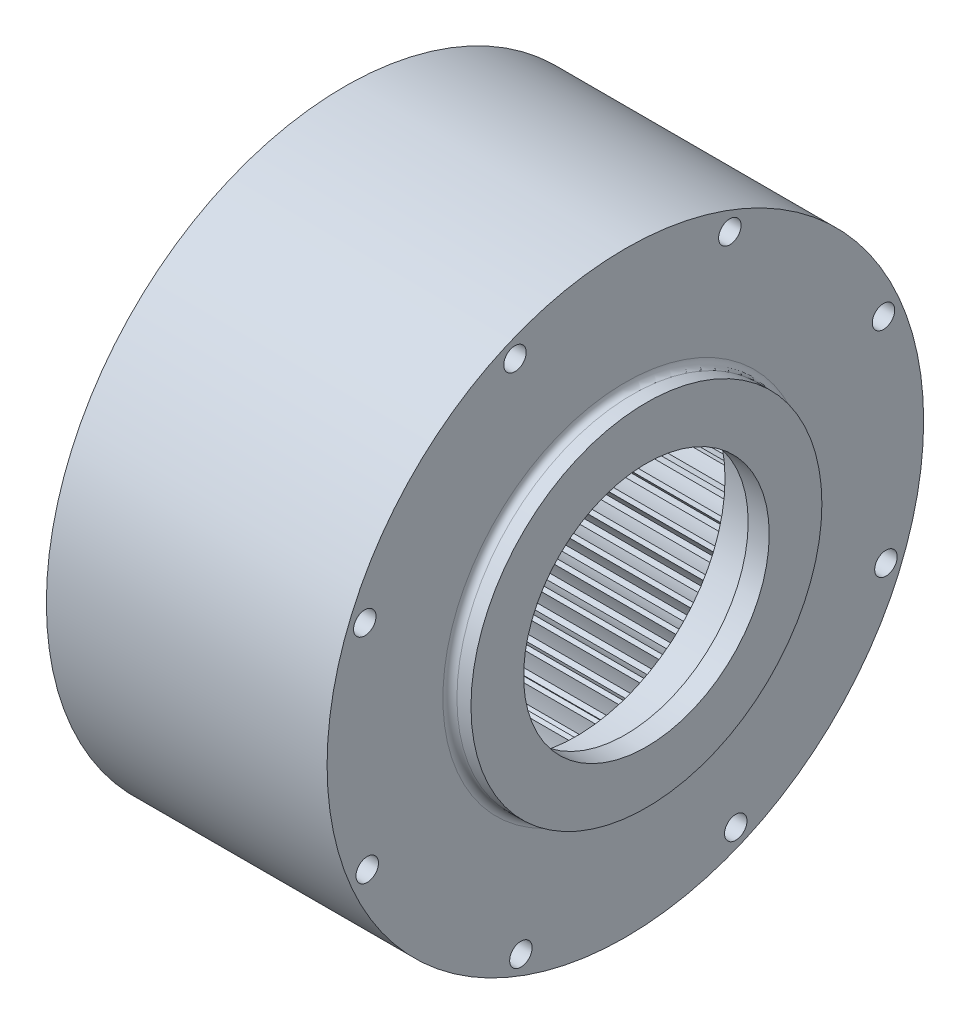
from build123d import *

# Parameters (mm, degrees)
BASPROSKE_W         = 30
BASPROSKE_H         = 8.5
TOOTHCUT_DEPTH      = 68.175144213
TEETHCUTS_COUNT     = 70
TEETHCUTS_ANGLE     = 354.857142857
BOSS_EXTRUDE1_START = 7
SKETCH1_R           = 42.5
SKETCH1_R_2         = 21.2
BOSS_EXTRUDE1_DEPTH = 7
SKETCH2_R           = 24.999999999
SKETCH2_R_2         = 17.499999999
BOSS_EXTRUDE2_DEPTH = 3
FILLET1_R           = 1
SKETCH4_R           = 42.5
BOSS_EXTRUDE3_DEPTH = 3
SKETCH5_R           = 1.6
CUT_EXTRUDE1_DEPTH  = 10
CUT_EXTRUDE2_START  = -20
SKETCH6_R           = 1.6
CUT_EXTRUDE2_DEPTH  = 20


with BuildPart() as part:
    # BasProSke → Base-Revolve (revolve)
    with BuildSketch(Plane(origin=(0, 0, 0), x_dir=(1, 0, 0), z_dir=(0, 1, 0))):
        with Locations((15, 38.25)):
            Rectangle(BASPROSKE_W, BASPROSKE_H)
    revolve(axis=Axis((-10, 0, 0), (1, 0, 0)))

    # TooCutSke → ToothCut (cut, through all)
    with BuildSketch(Plane(origin=(0, 0, 0), x_dir=(0, 0, -1), z_dir=(1, 0, 0))):
        with BuildLine():
            ThreePointArc((1.226311931, 33.952460945), (0.832867774, 35.11607546), (0.358768615, 36.249224627))
            ThreePointArc((0.358768615, 36.249224627), (0, 36.251), (-0.358768615, 36.249224627))
            ThreePointArc((-0.358768615, 36.249224627), (-0.832867774, 35.11607546), (-1.226311931, 33.952460945))
            ThreePointArc((-1.226311931, 33.952460945), (0, 33.9746), (1.226311931, 33.952460945))
        make_face()
    toothcut = extrude(amount=TOOTHCUT_DEPTH, mode=Mode.SUBTRACT)

    # TeethCuts: ToothCut ×70 about axis
    teethcuts_axis = Axis((-10, 0, 0), (1, 0, 0))
    for i in range(1, TEETHCUTS_COUNT):
        add(toothcut.rotate(teethcuts_axis, i * TEETHCUTS_ANGLE / (TEETHCUTS_COUNT - 1)), mode=Mode.SUBTRACT)

    # Sketch1 → Boss-Extrude1 (add)
    with BuildSketch(Plane(origin=(30, 0, 0), x_dir=(0, 0, -1), z_dir=(1, 0, 0)).offset(BOSS_EXTRUDE1_START)):
        Circle(SKETCH1_R)
        Circle(SKETCH1_R_2, mode=Mode.SUBTRACT)
    extrude(amount=-BOSS_EXTRUDE1_DEPTH)

    # Sketch2 → Boss-Extrude2 (add)
    with BuildSketch(Plane(origin=(37, 0, 0), x_dir=(0, 0, -1), z_dir=(1, 0, 0))):
        with Locations((4e-09, -9e-09)):
            Circle(SKETCH2_R)
        with Locations((4e-09, -9e-09)):
            Circle(SKETCH2_R_2, mode=Mode.SUBTRACT)
    extrude(amount=BOSS_EXTRUDE2_DEPTH)

    # Fillet1
    fillet1_edges = [part.edges().sort_by_distance(p)[0] for p in [
        (37, -9e-09, 24.999999995),
    ]]
    fillet(fillet1_edges, radius=FILLET1_R)

    # Sketch4 → Boss-Extrude3 (add)
    with BuildSketch(Plane.ZY):
        Circle(SKETCH4_R)
        with BuildLine():
            ThreePointArc((-21.59700955, 29.115359855), (-21.307803181, 29.327675063), (-21.016509736, 29.537117657))
            ThreePointArc((-21.016509736, 29.537117657), (-19.978120328, 28.906410813), (-18.985993298, 28.205177867))
            ThreePointArc((-18.985993298, 28.205177867), (-18.730497369, 28.375490627), (-18.473473761, 28.543489051))
            ThreePointArc((-18.473473761, 28.543489051), (-18.728346173, 29.731379509), (-18.900185603, 30.934090987))
            ThreePointArc((-18.900185603, 30.934090987), (-18.593111705, 31.119627217), (-18.284216633, 31.302115314))
            ThreePointArc((-18.284216633, 31.302115314), (-17.3065436, 30.580867001), (-16.381268619, 29.793523431))
            ThreePointArc((-16.381268619, 29.793523431), (-16.111534524, 29.940248083), (-15.840486355, 30.084530776))
            ThreePointArc((-15.840486355, 30.084530776), (-15.987851045, 31.290485724), (-16.051188474, 32.503759007))
            ThreePointArc((-16.051188474, 32.503759007), (-15.728719427, 32.66102243), (-15.404709768, 32.815086743))
            ThreePointArc((-15.404709768, 32.815086743), (-14.49562476, 32.009104028), (-13.644651597, 31.141989063))
            ThreePointArc((-13.644651597, 31.141989063), (-13.362851076, 31.263944267), (-13.079960666, 31.38334955))
            ThreePointArc((-13.079960666, 31.38334955), (-13.118631142, 32.597659346), (-13.072956614, 33.811725871))
            ThreePointArc((-13.072956614, 33.811725871), (-12.737688748, 33.939450296), (-12.401173239, 34.063850389))
            ThreePointArc((-12.401173239, 34.063850389), (-11.567995673, 33.179622572), (-10.798175864, 32.23971771))
            ThreePointArc((-10.798175864, 32.23971771), (-10.506577809, 32.335921554), (-10.214122826, 32.429488046))
            ThreePointArc((-10.214122826, 32.429488046), (-10.143787734, 33.642375783), (-9.989468995, 34.847460599))
            ThreePointArc((-9.989468995, 34.847460599), (-9.644101689, 34.944617663), (-9.297789754, 35.03835194))
            ThreePointArc((-9.297789754, 35.03835194), (-8.547227886, 34.082998304), (-7.864759568, 33.077871106))
            ThreePointArc((-7.864759568, 33.077871106), (-7.565711755, 33.147549014), (-7.266046873, 33.214523372))
            ThreePointArc((-7.266046873, 33.214523372), (-7.087272512, 34.416223591), (-6.825552044, 35.602624065))
            ThreePointArc((-6.825552044, 35.602624065), (-6.472865993, 35.668431516), (-6.119545932, 35.730745284))
            ThreePointArc((-6.119545932, 35.730745284), (-5.457642846, 34.711957773), (-4.868020852, 33.649700935))
            ThreePointArc((-4.868020852, 33.649700935), (-4.563931038, 33.6922919), (-4.259468984, 33.732134886))
            ThreePointArc((-4.259468984, 33.732134886), (-3.973694739, 34.912972203), (-3.606679762, 36.071136135))
            ThreePointArc((-3.606679762, 36.071136135), (-3.249514587, 36.105064132), (-2.892031126, 36.135455677))
            ThreePointArc((-2.892031126, 36.135455677), (-2.324116075, 35.06143697), (-1.832087695, 33.950603156))
            ThreePointArc((-1.832087695, 33.950603156), (-1.525404232, 33.965764262), (-1.218596355, 33.978155084))
            ThreePointArc((-1.218596355, 33.978155084), (-0.828123112, 35.128622091), (-0.358768615, 36.249224627))
            ThreePointArc((-0.358768615, 36.249224627), (0, 36.251), (0.358768615, 36.249224627))
            ThreePointArc((0.358768615, 36.249224627), (0.828123112, 35.128622091), (1.218596355, 33.978155084))
            ThreePointArc((1.218596355, 33.978155084), (1.525404232, 33.965764262), (1.832087695, 33.950603156))
            ThreePointArc((1.832087695, 33.950603156), (2.324116075, 35.06143697), (2.892031126, 36.135455677))
            ThreePointArc((2.892031126, 36.135455677), (3.249514587, 36.105064132), (3.606679762, 36.071136135))
            ThreePointArc((3.606679762, 36.071136135), (3.973694739, 34.912972203), (4.259468984, 33.732134886))
            ThreePointArc((4.259468984, 33.732134886), (4.563931038, 33.6922919), (4.868020852, 33.649700935))
            ThreePointArc((4.868020852, 33.649700935), (5.457642846, 34.711957773), (6.119545932, 35.730745284))
            ThreePointArc((6.119545932, 35.730745284), (6.472865993, 35.668431516), (6.825552044, 35.602624065))
            ThreePointArc((6.825552044, 35.602624065), (7.087272512, 34.416223591), (7.266046873, 33.214523372))
            ThreePointArc((7.266046873, 33.214523372), (7.565711755, 33.147549014), (7.864759568, 33.077871106))
            ThreePointArc((7.864759568, 33.077871106), (8.547227886, 34.082998304), (9.297789754, 35.03835194))
            ThreePointArc((9.297789754, 35.03835194), (9.644101689, 34.944617663), (9.989468995, 34.847460599))
            ThreePointArc((9.989468995, 34.847460599), (10.143787734, 33.642375783), (10.214122826, 32.429488046))
            ThreePointArc((10.214122826, 32.429488046), (10.506577809, 32.335921554), (10.798175864, 32.23971771))
            ThreePointArc((10.798175864, 32.23971771), (11.567995673, 33.179622572), (12.401173239, 34.063850389))
            ThreePointArc((12.401173239, 34.063850389), (12.737688748, 33.939450296), (13.072956614, 33.811725871))
            ThreePointArc((13.072956614, 33.811725871), (13.118631142, 32.597659346), (13.079960666, 31.38334955))
            ThreePointArc((13.079960666, 31.38334955), (13.362851076, 31.263944267), (13.644651597, 31.141989063))
            ThreePointArc((13.644651597, 31.141989063), (14.49562476, 32.009104028), (15.404709768, 32.815086743))
            ThreePointArc((15.404709768, 32.815086743), (15.728719427, 32.66102243), (16.051188474, 32.503759007))
            ThreePointArc((16.051188474, 32.503759007), (15.987851045, 31.290485724), (15.840486355, 30.084530776))
            ThreePointArc((15.840486355, 30.084530776), (16.111534524, 29.940248083), (16.381268619, 29.793523431))
            ThreePointArc((16.381268619, 29.793523431), (17.306543601, 30.580867001), (18.284216633, 31.302115314))
            ThreePointArc((18.284216633, 31.302115314), (18.593111705, 31.119627217), (18.900185603, 30.934090987))
            ThreePointArc((18.900185603, 30.934090987), (18.728346173, 29.731379509), (18.473473761, 28.543489051))
            ThreePointArc((18.473473761, 28.543489051), (18.730497369, 28.375490627), (18.985993298, 28.205177867))
            ThreePointArc((18.985993298, 28.205177867), (19.978120328, 28.906410813), (21.016509736, 29.537117657))
            ThreePointArc((21.016509736, 29.537117657), (21.307803181, 29.327675063), (21.59700955, 29.115359855))
            ThreePointArc((21.59700955, 29.115359855), (21.318051669, 27.932893708), (20.957723619, 26.772631934))
            ThreePointArc((20.957723619, 26.772631934), (21.198653263, 26.582270404), (21.437853922, 26.389740795))
            ThreePointArc((21.437853922, 26.389740795), (22.488844977, 26.999217202), (23.579590261, 27.534304497))
            ThreePointArc((23.579590261, 27.534304497), (23.850936754, 27.299593714), (24.119947075, 27.062208966))
            ThreePointArc((24.119947075, 27.062208966), (23.736116748, 25.909508672), (23.27323421, 24.786217328))
            ThreePointArc((23.27323421, 24.786217328), (23.496130066, 24.57502537), (23.717109552, 24.361829047))
            ThreePointArc((23.717109552, 24.361829047), (24.818502669, 24.874641769), (25.952821789, 25.309801307))
            ThreePointArc((25.952821789, 25.309801307), (26.202036609, 25.051712088), (26.448684968, 24.791169082))
            ThreePointArc((26.448684968, 24.791169082), (25.963072572, 23.677515506), (25.401362403, 22.600238673))
            ThreePointArc((25.401362403, 22.600238673), (25.604429844, 22.369916682), (25.805408961, 22.137770176))
            ThreePointArc((25.805408961, 22.137770176), (26.948336372, 22.549790347), (28.117096456, 22.881518479))
            ThreePointArc((28.117096456, 22.881518479), (28.342173071, 22.602128807), (28.564473601, 22.320525282))
            ThreePointArc((28.564473601, 22.320525282), (27.980989001, 21.254884907), (27.324973761, 20.232296186))
            ThreePointArc((27.324973761, 20.232296186), (27.506577809, 19.984698578), (27.68593839, 19.735470996))
            ThreePointArc((27.68593839, 19.735470996), (28.861197915, 20.043381272), (30.054988795, 20.269007118))
            ThreePointArc((30.054988795, 20.269007118), (30.254115021, 19.970566475), (30.450277889, 19.670169737))
            ThreePointArc((30.450277889, 19.670169737), (29.77361896, 18.661122473), (29.028580498, 17.701455146))
            ThreePointArc((29.028580498, 17.701455146), (29.187258982, 17.438575432), (29.343556923, 17.174273409))
            ThreePointArc((29.343556923, 17.174273409), (30.541686062, 17.375594677), (31.750896036, 17.493301629))
            ThreePointArc((31.750896036, 17.493301629), (31.922468625, 17.178212883), (32.090914444, 16.86144155))
            ThreePointArc((32.090914444, 16.86144155), (31.326529245, 15.917111653), (30.498466173, 15.028092397))
            ThreePointArc((30.498466173, 15.028092397), (30.632941509, 14.75204713), (30.764918389, 14.47479867))
            ThreePointArc((30.764918389, 14.47479867), (31.976270512, 14.56791001), (33.191163732, 14.576750362))
            ThreePointArc((33.191163732, 14.576750362), (33.333801283, 14.247550422), (33.473173825, 13.916954951))
            ThreePointArc((33.473173825, 13.916954951), (32.627216736, 13.044945609), (31.722796131, 12.233732285))
            ThreePointArc((31.722796131, 12.233732285), (31.831985602, 11.946744019), (31.938578821, 11.658781363))
            ThreePointArc((31.938578821, 11.658781363), (33.153400833, 11.642933097), (34.364195693, 11.542835672))
            ThreePointArc((34.364195693, 11.542835672), (34.476749772, 11.202175063), (34.585926892, 10.860417214))
            ThreePointArc((34.585926892, 10.860417214), (33.665209063, 10.067749333), (32.691712788, 9.340873354))
            ThreePointArc((32.691712788, 9.340873354), (32.774737264, 9.045252749), (32.855088597, 8.748894404))
            ThreePointArc((32.855088597, 8.748894404), (34.063599465, 8.624214133), (35.260547357, 8.415984856))
            ThreePointArc((35.260547357, 8.415984856), (35.342111745, 8.066606377), (35.420214411, 7.716437782))
            ThreePointArc((35.420214411, 7.716437782), (34.432148921, 7.00949346), (33.397414995, 6.372807203))
            ThreePointArc((33.397414995, 6.372807203), (33.453606012, 6.070934423), (33.507068517, 5.768566492))
            ThreePointArc((33.507068517, 5.768566492), (34.699538023, 5.536058067), (35.873001826, 5.221373479))
            ThreePointArc((35.873001826, 5.221373479), (35.922919814, 4.866090119), (35.969319192, 4.510330131))
            ThreePointArc((35.969319192, 4.510330131), (34.921861362, 3.894801267), (33.834220854, 3.353430955))
            ThreePointArc((33.834220854, 3.353430955), (33.863125996, 3.047736503), (33.889269224, 2.741793473))
            ThreePointArc((33.889269224, 2.741793473), (35.056096303, 2.403328917), (36.196627977, 1.984722672))
            ThreePointArc((36.196627977, 1.984722672), (36.214497655, 1.626394965), (36.228820163, 1.267907954))
            ThreePointArc((36.228820163, 1.267907954), (35.130403509, 0.748750424), (33.998613462, 0.307054853))
            ThreePointArc((33.998613462, 0.307054853), (34, 0), (33.998613462, -0.307054853))
            ThreePointArc((33.998613462, -0.307054853), (35.130403509, -0.748750424), (36.228820163, -1.267907954))
            ThreePointArc((36.228820163, -1.267907954), (36.214497655, -1.626394965), (36.196627977, -1.984722672))
            ThreePointArc((36.196627977, -1.984722672), (35.056096303, -2.403328917), (33.889269224, -2.741793473))
            ThreePointArc((33.889269224, -2.741793473), (33.863125996, -3.047736503), (33.834220854, -3.353430955))
            ThreePointArc((33.834220854, -3.353430955), (34.921861362, -3.894801267), (35.969319192, -4.510330131))
            ThreePointArc((35.969319192, -4.510330131), (35.922919814, -4.866090119), (35.873001826, -5.221373479))
            ThreePointArc((35.873001826, -5.221373479), (34.699538023, -5.536058067), (33.507068517, -5.768566492))
            ThreePointArc((33.507068517, -5.768566492), (33.453606012, -6.070934423), (33.397414995, -6.372807203))
            ThreePointArc((33.397414995, -6.372807203), (34.432148921, -7.00949346), (35.420214411, -7.716437782))
            ThreePointArc((35.420214411, -7.716437782), (35.342111745, -8.066606377), (35.260547357, -8.415984856))
            ThreePointArc((35.260547357, -8.415984856), (34.063599465, -8.624214133), (32.855088597, -8.748894404))
            ThreePointArc((32.855088597, -8.748894404), (32.774737264, -9.045252749), (32.691712788, -9.340873354))
            ThreePointArc((32.691712788, -9.340873354), (33.665209063, -10.067749333), (34.585926892, -10.860417214))
            ThreePointArc((34.585926892, -10.860417214), (34.476749772, -11.202175063), (34.364195693, -11.542835672))
            ThreePointArc((34.364195693, -11.542835672), (33.153400833, -11.642933097), (31.938578821, -11.658781363))
            ThreePointArc((31.938578821, -11.658781363), (31.831985602, -11.946744019), (31.722796131, -12.233732285))
            ThreePointArc((31.722796131, -12.233732285), (32.627216736, -13.044945609), (33.473173825, -13.916954951))
            ThreePointArc((33.473173825, -13.916954951), (33.333801283, -14.247550422), (33.191163732, -14.576750362))
            ThreePointArc((33.191163732, -14.576750362), (31.976270512, -14.56791001), (30.764918389, -14.47479867))
            ThreePointArc((30.764918389, -14.47479867), (30.632941509, -14.75204713), (30.498466173, -15.028092397))
            ThreePointArc((30.498466173, -15.028092397), (31.326529245, -15.917111653), (32.090914444, -16.86144155))
            ThreePointArc((32.090914444, -16.86144155), (31.922468625, -17.178212883), (31.750896036, -17.493301629))
            ThreePointArc((31.750896036, -17.493301629), (30.541686062, -17.375594677), (29.343556923, -17.174273409))
            ThreePointArc((29.343556923, -17.174273409), (29.187258982, -17.438575432), (29.028580498, -17.701455146))
            ThreePointArc((29.028580498, -17.701455146), (29.77361896, -18.661122473), (30.450277889, -19.670169737))
            ThreePointArc((30.450277889, -19.670169737), (30.254115021, -19.970566475), (30.054988795, -20.269007118))
            ThreePointArc((30.054988795, -20.269007118), (28.861197915, -20.043381272), (27.68593839, -19.735470997))
            ThreePointArc((27.68593839, -19.735470997), (27.506577809, -19.984698578), (27.324973761, -20.232296186))
            ThreePointArc((27.324973761, -20.232296186), (27.980989001, -21.254884907), (28.564473601, -22.320525282))
            ThreePointArc((28.564473601, -22.320525282), (28.342173071, -22.602128807), (28.117096456, -22.881518479))
            ThreePointArc((28.117096456, -22.881518479), (26.948336372, -22.549790347), (25.805408961, -22.137770176))
            ThreePointArc((25.805408961, -22.137770176), (25.604429844, -22.369916682), (25.401362403, -22.600238673))
            ThreePointArc((25.401362403, -22.600238673), (25.963072572, -23.677515506), (26.448684968, -24.791169082))
            ThreePointArc((26.448684968, -24.791169082), (26.202036609, -25.051712088), (25.952821789, -25.309801307))
            ThreePointArc((25.952821789, -25.309801307), (24.818502669, -24.874641769), (23.717109552, -24.361829047))
            ThreePointArc((23.717109552, -24.361829047), (23.496130066, -24.57502537), (23.27323421, -24.786217328))
            ThreePointArc((23.27323421, -24.786217328), (23.736116748, -25.909508672), (24.119947075, -27.062208966))
            ThreePointArc((24.119947075, -27.062208966), (23.850936754, -27.299593714), (23.579590261, -27.534304497))
            ThreePointArc((23.579590261, -27.534304497), (22.488844977, -26.999217202), (21.437853922, -26.389740795))
            ThreePointArc((21.437853922, -26.389740795), (21.198653263, -26.582270404), (20.957723619, -26.772631934))
            ThreePointArc((20.957723619, -26.772631934), (21.318051669, -27.932893708), (21.59700955, -29.115359855))
            ThreePointArc((21.59700955, -29.115359855), (21.307803181, -29.327675063), (21.016509736, -29.537117657))
            ThreePointArc((21.016509736, -29.537117657), (19.978120328, -28.906410813), (18.985993298, -28.205177867))
            ThreePointArc((18.985993298, -28.205177867), (18.730497369, -28.375490627), (18.473473761, -28.543489051))
            ThreePointArc((18.473473761, -28.543489051), (18.728346173, -29.731379509), (18.900185603, -30.934090987))
            ThreePointArc((18.900185603, -30.934090987), (18.593111705, -31.119627217), (18.284216633, -31.302115314))
            ThreePointArc((18.284216633, -31.302115314), (17.306543601, -30.580867001), (16.381268619, -29.793523431))
            ThreePointArc((16.381268619, -29.793523431), (16.111534524, -29.940248083), (15.840486355, -30.084530776))
            ThreePointArc((15.840486355, -30.084530776), (15.987851045, -31.290485724), (16.051188474, -32.503759007))
            ThreePointArc((16.051188474, -32.503759007), (15.728719427, -32.66102243), (15.404709768, -32.815086743))
            ThreePointArc((15.404709768, -32.815086743), (14.49562476, -32.009104028), (13.644651597, -31.141989063))
            ThreePointArc((13.644651597, -31.141989063), (13.362851076, -31.263944267), (13.079960666, -31.38334955))
            ThreePointArc((13.079960666, -31.38334955), (13.118631142, -32.597659346), (13.072956614, -33.811725871))
            ThreePointArc((13.072956614, -33.811725871), (12.737688748, -33.939450296), (12.401173239, -34.063850389))
            ThreePointArc((12.401173239, -34.063850389), (11.567995673, -33.179622572), (10.798175864, -32.23971771))
            ThreePointArc((10.798175864, -32.23971771), (10.506577809, -32.335921554), (10.214122826, -32.429488046))
            ThreePointArc((10.214122826, -32.429488046), (10.143787734, -33.642375783), (9.989468995, -34.847460599))
            ThreePointArc((9.989468995, -34.847460599), (9.644101689, -34.944617663), (9.297789754, -35.03835194))
            ThreePointArc((9.297789754, -35.03835194), (8.547227886, -34.082998304), (7.864759568, -33.077871107))
            ThreePointArc((7.864759568, -33.077871107), (7.565711755, -33.147549014), (7.266046873, -33.214523372))
            ThreePointArc((7.266046873, -33.214523372), (7.087272512, -34.416223591), (6.825552044, -35.602624065))
            ThreePointArc((6.825552044, -35.602624065), (6.472865993, -35.668431516), (6.119545932, -35.730745284))
            ThreePointArc((6.119545932, -35.730745284), (5.457642846, -34.711957773), (4.868020852, -33.649700935))
            ThreePointArc((4.868020852, -33.649700935), (4.563931038, -33.6922919), (4.259468984, -33.732134886))
            ThreePointArc((4.259468984, -33.732134886), (3.973694739, -34.912972203), (3.606679762, -36.071136135))
            ThreePointArc((3.606679762, -36.071136135), (3.249514587, -36.105064132), (2.892031126, -36.135455677))
            ThreePointArc((2.892031126, -36.135455677), (2.324116075, -35.06143697), (1.832087695, -33.950603156))
            ThreePointArc((1.832087695, -33.950603156), (1.525404232, -33.965764262), (1.218596355, -33.978155084))
            ThreePointArc((1.218596355, -33.978155084), (0.828123112, -35.128622091), (0.358768615, -36.249224627))
            ThreePointArc((0.358768615, -36.249224627), (0, -36.251), (-0.358768615, -36.249224627))
            ThreePointArc((-0.358768615, -36.249224627), (-0.828123112, -35.128622091), (-1.218596355, -33.978155084))
            ThreePointArc((-1.218596355, -33.978155084), (-1.525404232, -33.965764262), (-1.832087695, -33.950603156))
            ThreePointArc((-1.832087695, -33.950603156), (-2.324116075, -35.06143697), (-2.892031126, -36.135455677))
            ThreePointArc((-2.892031126, -36.135455677), (-3.249514587, -36.105064132), (-3.606679762, -36.071136135))
            ThreePointArc((-3.606679762, -36.071136135), (-3.973694739, -34.912972203), (-4.259468984, -33.732134886))
            ThreePointArc((-4.259468984, -33.732134886), (-4.563931038, -33.6922919), (-4.868020852, -33.649700935))
            ThreePointArc((-4.868020852, -33.649700935), (-5.457642846, -34.711957773), (-6.119545932, -35.730745284))
            ThreePointArc((-6.119545932, -35.730745284), (-6.472865993, -35.668431516), (-6.825552044, -35.602624065))
            ThreePointArc((-6.825552044, -35.602624065), (-7.087272512, -34.416223591), (-7.266046873, -33.214523372))
            ThreePointArc((-7.266046873, -33.214523372), (-7.565711755, -33.147549014), (-7.864759568, -33.077871107))
            ThreePointArc((-7.864759568, -33.077871107), (-8.547227886, -34.082998304), (-9.297789754, -35.03835194))
            ThreePointArc((-9.297789754, -35.03835194), (-9.644101689, -34.944617663), (-9.989468995, -34.847460599))
            ThreePointArc((-9.989468995, -34.847460599), (-10.143787734, -33.642375783), (-10.214122826, -32.429488046))
            ThreePointArc((-10.214122826, -32.429488046), (-10.506577809, -32.335921554), (-10.798175864, -32.23971771))
            ThreePointArc((-10.798175864, -32.23971771), (-11.567995673, -33.179622572), (-12.401173239, -34.063850389))
            ThreePointArc((-12.401173239, -34.063850389), (-12.737688748, -33.939450296), (-13.072956614, -33.811725871))
            ThreePointArc((-13.072956614, -33.811725871), (-13.118631142, -32.597659346), (-13.079960666, -31.38334955))
            ThreePointArc((-13.079960666, -31.38334955), (-13.362851076, -31.263944267), (-13.644651597, -31.141989063))
            ThreePointArc((-13.644651597, -31.141989063), (-14.49562476, -32.009104028), (-15.404709768, -32.815086743))
            ThreePointArc((-15.404709768, -32.815086743), (-15.728719427, -32.66102243), (-16.051188474, -32.503759007))
            ThreePointArc((-16.051188474, -32.503759007), (-15.987851045, -31.290485724), (-15.840486355, -30.084530776))
            ThreePointArc((-15.840486355, -30.084530776), (-16.111534524, -29.940248083), (-16.381268619, -29.793523431))
            ThreePointArc((-16.381268619, -29.793523431), (-17.3065436, -30.580867001), (-18.284216633, -31.302115314))
            ThreePointArc((-18.284216633, -31.302115314), (-18.593111705, -31.119627217), (-18.900185603, -30.934090987))
            ThreePointArc((-18.900185603, -30.934090987), (-18.728346173, -29.731379509), (-18.473473761, -28.543489051))
            ThreePointArc((-18.473473761, -28.543489051), (-18.730497369, -28.375490627), (-18.985993298, -28.205177867))
            ThreePointArc((-18.985993298, -28.205177867), (-19.978120328, -28.906410813), (-21.016509736, -29.537117657))
            ThreePointArc((-21.016509736, -29.537117657), (-21.307803181, -29.327675063), (-21.59700955, -29.115359855))
            ThreePointArc((-21.59700955, -29.115359855), (-21.318051669, -27.932893708), (-20.957723619, -26.772631934))
            ThreePointArc((-20.957723619, -26.772631934), (-21.198653263, -26.582270404), (-21.437853922, -26.389740795))
            ThreePointArc((-21.437853922, -26.389740795), (-22.488844977, -26.999217202), (-23.579590261, -27.534304497))
            ThreePointArc((-23.579590261, -27.534304497), (-23.850936754, -27.299593714), (-24.119947075, -27.062208966))
            ThreePointArc((-24.119947075, -27.062208966), (-23.736116748, -25.909508672), (-23.27323421, -24.786217328))
            ThreePointArc((-23.27323421, -24.786217328), (-23.496130066, -24.57502537), (-23.717109552, -24.361829047))
            ThreePointArc((-23.717109552, -24.361829047), (-24.818502669, -24.874641769), (-25.952821789, -25.309801307))
            ThreePointArc((-25.952821789, -25.309801307), (-26.202036609, -25.051712088), (-26.448684968, -24.791169082))
            ThreePointArc((-26.448684968, -24.791169082), (-25.963072572, -23.677515506), (-25.401362403, -22.600238673))
            ThreePointArc((-25.401362403, -22.600238673), (-25.604429844, -22.369916682), (-25.805408961, -22.137770176))
            ThreePointArc((-25.805408961, -22.137770176), (-26.948336372, -22.549790347), (-28.117096456, -22.881518479))
            ThreePointArc((-28.117096456, -22.881518479), (-28.342173071, -22.602128807), (-28.564473601, -22.320525282))
            ThreePointArc((-28.564473601, -22.320525282), (-27.980989001, -21.254884907), (-27.324973761, -20.232296186))
            ThreePointArc((-27.324973761, -20.232296186), (-27.506577809, -19.984698578), (-27.68593839, -19.735470996))
            ThreePointArc((-27.68593839, -19.735470996), (-28.861197915, -20.043381272), (-30.054988795, -20.269007118))
            ThreePointArc((-30.054988795, -20.269007118), (-30.254115021, -19.970566475), (-30.450277889, -19.670169737))
            ThreePointArc((-30.450277889, -19.670169737), (-29.77361896, -18.661122473), (-29.028580498, -17.701455146))
            ThreePointArc((-29.028580498, -17.701455146), (-29.187258982, -17.438575432), (-29.343556923, -17.174273409))
            ThreePointArc((-29.343556923, -17.174273409), (-30.541686062, -17.375594677), (-31.750896036, -17.493301629))
            ThreePointArc((-31.750896036, -17.493301629), (-31.922468625, -17.178212883), (-32.090914444, -16.86144155))
            ThreePointArc((-32.090914444, -16.86144155), (-31.326529245, -15.917111653), (-30.498466173, -15.028092397))
            ThreePointArc((-30.498466173, -15.028092397), (-30.632941509, -14.75204713), (-30.764918389, -14.47479867))
            ThreePointArc((-30.764918389, -14.47479867), (-31.976270512, -14.56791001), (-33.191163732, -14.576750362))
            ThreePointArc((-33.191163732, -14.576750362), (-33.333801283, -14.247550422), (-33.473173825, -13.916954951))
            ThreePointArc((-33.473173825, -13.916954951), (-32.627216736, -13.044945609), (-31.722796131, -12.233732285))
            ThreePointArc((-31.722796131, -12.233732285), (-31.831985602, -11.946744019), (-31.938578821, -11.658781363))
            ThreePointArc((-31.938578821, -11.658781363), (-33.153400833, -11.642933097), (-34.364195693, -11.542835672))
            ThreePointArc((-34.364195693, -11.542835672), (-34.476749772, -11.202175063), (-34.585926892, -10.860417214))
            ThreePointArc((-34.585926892, -10.860417214), (-33.665209063, -10.067749333), (-32.691712788, -9.340873354))
            ThreePointArc((-32.691712788, -9.340873354), (-32.774737264, -9.045252749), (-32.855088597, -8.748894404))
            ThreePointArc((-32.855088597, -8.748894404), (-34.063599465, -8.624214133), (-35.260547357, -8.415984856))
            ThreePointArc((-35.260547357, -8.415984856), (-35.342111745, -8.066606377), (-35.420214411, -7.716437782))
            ThreePointArc((-35.420214411, -7.716437782), (-34.432148921, -7.00949346), (-33.397414995, -6.372807203))
            ThreePointArc((-33.397414995, -6.372807203), (-33.453606012, -6.070934423), (-33.507068517, -5.768566492))
            ThreePointArc((-33.507068517, -5.768566492), (-34.699538023, -5.536058067), (-35.873001826, -5.221373479))
            ThreePointArc((-35.873001826, -5.221373479), (-35.922919814, -4.866090119), (-35.969319192, -4.510330131))
            ThreePointArc((-35.969319192, -4.510330131), (-34.921861362, -3.894801267), (-33.834220854, -3.353430955))
            ThreePointArc((-33.834220854, -3.353430955), (-33.863125996, -3.047736503), (-33.889269224, -2.741793473))
            ThreePointArc((-33.889269224, -2.741793473), (-35.056096303, -2.403328917), (-36.196627977, -1.984722672))
            ThreePointArc((-36.196627977, -1.984722672), (-36.214497655, -1.626394965), (-36.228820163, -1.267907954))
            ThreePointArc((-36.228820163, -1.267907954), (-35.130403509, -0.748750424), (-33.998613462, -0.307054853))
            ThreePointArc((-33.998613462, -0.307054853), (-34, 0), (-33.998613462, 0.307054853))
            ThreePointArc((-33.998613462, 0.307054853), (-35.130403509, 0.748750424), (-36.228820163, 1.267907954))
            ThreePointArc((-36.228820163, 1.267907954), (-36.214497655, 1.626394965), (-36.196627977, 1.984722672))
            ThreePointArc((-36.196627977, 1.984722672), (-35.056096303, 2.403328917), (-33.889269224, 2.741793473))
            ThreePointArc((-33.889269224, 2.741793473), (-33.863125996, 3.047736503), (-33.834220854, 3.353430955))
            ThreePointArc((-33.834220854, 3.353430955), (-34.921861362, 3.894801267), (-35.969319192, 4.510330131))
            ThreePointArc((-35.969319192, 4.510330131), (-35.922919814, 4.866090119), (-35.873001826, 5.221373479))
            ThreePointArc((-35.873001826, 5.221373479), (-34.699538023, 5.536058067), (-33.507068517, 5.768566492))
            ThreePointArc((-33.507068517, 5.768566492), (-33.453606012, 6.070934423), (-33.397414995, 6.372807203))
            ThreePointArc((-33.397414995, 6.372807203), (-34.432148921, 7.00949346), (-35.420214411, 7.716437782))
            ThreePointArc((-35.420214411, 7.716437782), (-35.342111745, 8.066606377), (-35.260547357, 8.415984856))
            ThreePointArc((-35.260547357, 8.415984856), (-34.063599465, 8.624214133), (-32.855088597, 8.748894404))
            ThreePointArc((-32.855088597, 8.748894404), (-32.774737264, 9.045252749), (-32.691712788, 9.340873354))
            ThreePointArc((-32.691712788, 9.340873354), (-33.665209063, 10.067749333), (-34.585926892, 10.860417214))
            ThreePointArc((-34.585926892, 10.860417214), (-34.476749772, 11.202175063), (-34.364195693, 11.542835672))
            ThreePointArc((-34.364195693, 11.542835672), (-33.153400833, 11.642933097), (-31.938578821, 11.658781363))
            ThreePointArc((-31.938578821, 11.658781363), (-31.831985602, 11.946744019), (-31.722796131, 12.233732285))
            ThreePointArc((-31.722796131, 12.233732285), (-32.627216736, 13.044945609), (-33.473173825, 13.916954951))
            ThreePointArc((-33.473173825, 13.916954951), (-33.333801283, 14.247550422), (-33.191163732, 14.576750362))
            ThreePointArc((-33.191163732, 14.576750362), (-31.976270512, 14.56791001), (-30.764918389, 14.47479867))
            ThreePointArc((-30.764918389, 14.47479867), (-30.632941509, 14.75204713), (-30.498466173, 15.028092397))
            ThreePointArc((-30.498466173, 15.028092397), (-31.326529245, 15.917111653), (-32.090914444, 16.86144155))
            ThreePointArc((-32.090914444, 16.86144155), (-31.922468625, 17.178212883), (-31.750896036, 17.493301629))
            ThreePointArc((-31.750896036, 17.493301629), (-30.541686062, 17.375594677), (-29.343556923, 17.174273409))
            ThreePointArc((-29.343556923, 17.174273409), (-29.187258982, 17.438575432), (-29.028580498, 17.701455146))
            ThreePointArc((-29.028580498, 17.701455146), (-29.77361896, 18.661122473), (-30.450277889, 19.670169737))
            ThreePointArc((-30.450277889, 19.670169737), (-30.254115021, 19.970566475), (-30.054988795, 20.269007118))
            ThreePointArc((-30.054988795, 20.269007118), (-28.861197915, 20.043381272), (-27.68593839, 19.735470996))
            ThreePointArc((-27.68593839, 19.735470996), (-27.506577809, 19.984698578), (-27.324973761, 20.232296186))
            ThreePointArc((-27.324973761, 20.232296186), (-27.980989001, 21.254884907), (-28.564473601, 22.320525282))
            ThreePointArc((-28.564473601, 22.320525282), (-28.342173071, 22.602128807), (-28.117096456, 22.881518479))
            ThreePointArc((-28.117096456, 22.881518479), (-26.948336372, 22.549790347), (-25.805408961, 22.137770176))
            ThreePointArc((-25.805408961, 22.137770176), (-25.604429844, 22.369916682), (-25.401362403, 22.600238673))
            ThreePointArc((-25.401362403, 22.600238673), (-25.963072572, 23.677515506), (-26.448684968, 24.791169082))
            ThreePointArc((-26.448684968, 24.791169082), (-26.202036609, 25.051712088), (-25.952821789, 25.309801307))
            ThreePointArc((-25.952821789, 25.309801307), (-24.818502669, 24.874641769), (-23.717109552, 24.361829047))
            ThreePointArc((-23.717109552, 24.361829047), (-23.496130066, 24.57502537), (-23.27323421, 24.786217328))
            ThreePointArc((-23.27323421, 24.786217328), (-23.736116748, 25.909508672), (-24.119947075, 27.062208966))
            ThreePointArc((-24.119947075, 27.062208966), (-23.850936754, 27.299593714), (-23.579590261, 27.534304497))
            ThreePointArc((-23.579590261, 27.534304497), (-22.488844977, 26.999217202), (-21.437853922, 26.389740795))
            ThreePointArc((-21.437853922, 26.389740795), (-21.198653263, 26.582270404), (-20.957723619, 26.772631934))
            ThreePointArc((-20.957723619, 26.772631934), (-21.318051669, 27.932893708), (-21.59700955, 29.115359855))
        make_face(mode=Mode.SUBTRACT)
    extrude(amount=BOSS_EXTRUDE3_DEPTH)

    # Sketch5 → Cut-Extrude1 (cut)
    with BuildSketch(Plane(origin=(37, 0, 0), x_dir=(0, 0, -1), z_dir=(1, 0, 0))):
        with Locations((15.728333819, -36.777975954)):
            Circle(SKETCH5_R)
        with Locations((-14.884344692, -37.127567695)):
            Circle(SKETCH5_R)
        with Locations((-36.777975948, -15.728333821)):
            Circle(SKETCH5_R)
        with Locations((-37.127567689, 14.88434469)):
            Circle(SKETCH5_R)
        with Locations((-15.728333814, 36.777975946)):
            Circle(SKETCH5_R)
        with Locations((14.884344696, 37.127567687)):
            Circle(SKETCH5_R)
        with Locations((36.777975952, 15.728333812)):
            Circle(SKETCH5_R)
        with Locations((37.127567693, -14.884344698)):
            Circle(SKETCH5_R)
    extrude(amount=-CUT_EXTRUDE1_DEPTH, mode=Mode.SUBTRACT)

    # Sketch6 → Cut-Extrude2 (cut)
    with BuildSketch(Plane.ZY.offset(3).offset(CUT_EXTRUDE2_START)):
        with Locations((15.728333814, 36.777975946)):
            Circle(SKETCH6_R)
        with Locations((39.714828376, 4.76785133)):
            Circle(SKETCH6_R)
        with Locations((23.986494561, -32.010124615)):
            Circle(SKETCH6_R)
        with Locations((-15.728333814, -36.777975946)):
            Circle(SKETCH6_R)
        with Locations((-39.714828376, -4.76785133)):
            Circle(SKETCH6_R)
        with Locations((-23.986494561, 32.010124615)):
            Circle(SKETCH6_R)
    extrude(amount=CUT_EXTRUDE2_DEPTH, mode=Mode.SUBTRACT)


solid = part.part
